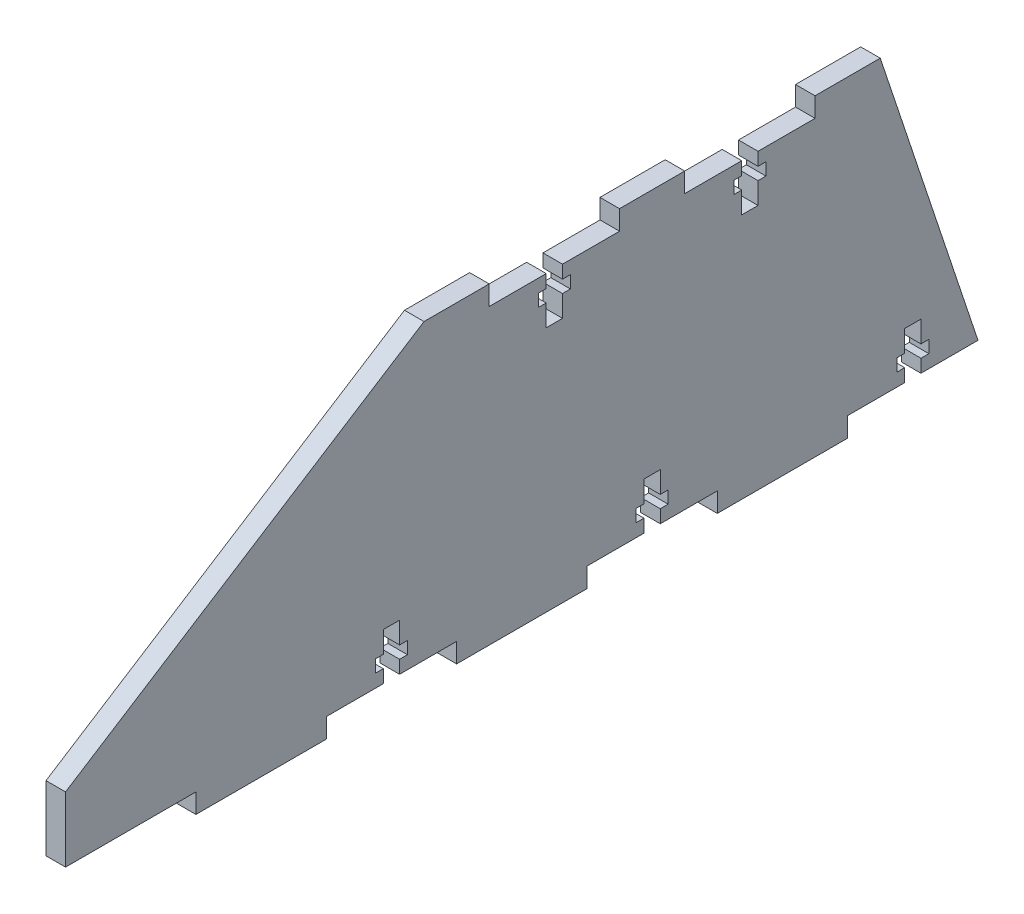
from build123d import *

# Parameters (mm, degrees)
BOSS_EXTRUDE1_DEPTH = 3.81


with BuildPart() as part:
    # Sketch1 → Boss-Extrude1 (new body)
    with BuildSketch(Plane(origin=(0, 0, 0), x_dir=(0, 0, -1), z_dir=(1, 0, 0))):
        Polygon((-88.9, 3.81), (-63.5, 3.81), (-63.5, 0), (-38.1, 0), (-38.1, 3.81), (-26.9875, 3.81), (-26.9875, 6.35), (-28.5242, 6.35), (-28.5242, 8.763), (-26.9875, 8.763), (-26.9875, 12.954), (-23.8125, 12.954), (-23.8125, 8.763), (-22.2758, 8.763), (-22.2758, 6.35), (-23.8125, 6.35), (-23.8125, 3.81), (-12.7, 3.81), (-12.7, 0), (12.7, 0), (12.7, 3.81), (23.8125, 3.81), (23.8125, 6.35), (22.2758, 6.35), (22.2758, 8.763), (23.8125, 8.763), (23.8125, 12.954), (26.9875, 12.954), (26.9875, 8.763), (28.5242, 8.763), (28.5242, 6.35), (26.9875, 6.35), (26.9875, 3.81), (38.1, 3.81), (38.1, 0), (63.5, 0), (63.5, 3.81), (74.6125, 3.81), (74.6125, 6.35), (73.0758, 6.35), (73.0758, 8.763), (74.6125, 8.763), (74.6125, 12.954), (77.7875, 12.954), (77.7875, 8.763), (79.3242, 8.763), (79.3242, 6.35), (77.7875, 6.35), (77.7875, 3.81), (88.9, 3.81), (69.85, 60.96), (57.15, 60.96), (57.15, 57.15), (46.0375, 57.15), (46.0375, 54.61), (47.5742, 54.61), (47.5742, 52.197), (46.0375, 52.197), (46.0375, 48.006), (42.8625, 48.006), (42.8625, 52.197), (41.3258, 52.197), (41.3258, 54.61), (42.8625, 54.61), (42.8625, 57.15), (31.75, 57.15), (31.75, 60.96), (19.05, 60.96), (19.05, 57.15), (7.9375, 57.15), (7.9375, 54.61), (9.4742, 54.61), (9.4742, 52.197), (7.9375, 52.197), (7.9375, 48.006), (4.7625, 48.006), (4.7625, 52.197), (3.2258, 52.197), (3.2258, 54.61), (4.7625, 54.61), (4.7625, 57.15), (-6.35, 57.15), (-6.35, 60.96), (-19.05, 60.96), (-88.9, 16.51), align=None)
    extrude(amount=BOSS_EXTRUDE1_DEPTH)


solid = part.part
